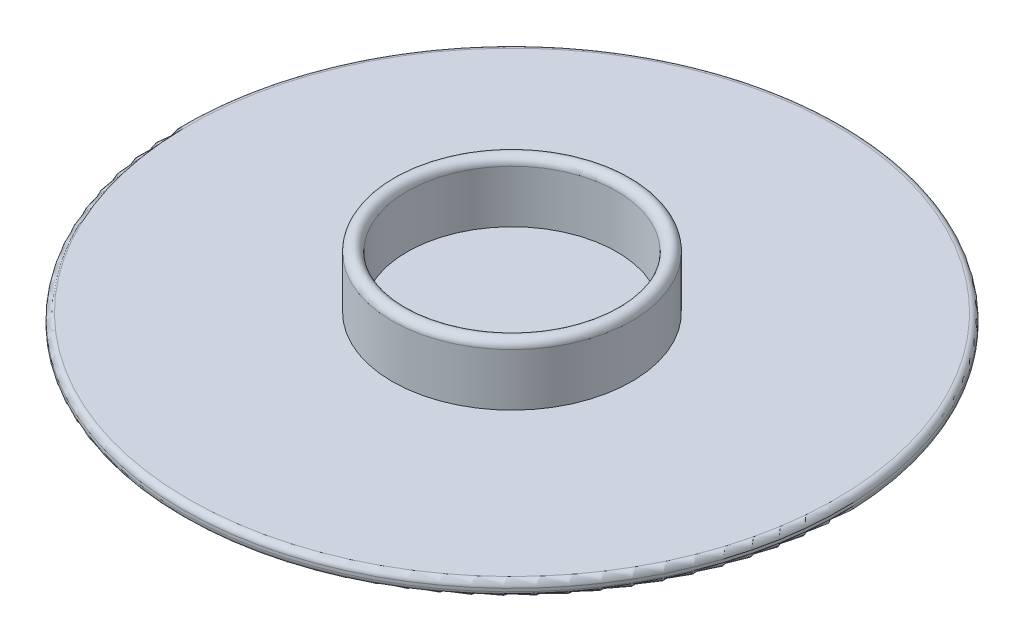
from build123d import *

# Parameters (mm, degrees)
SKETCH_1_R      = 11
EXTRUDE_1_DEPTH = 0.5
SKETCH_2_R      = 4
SKETCH_2_R_2    = 3.5
EXTRUDE_2_DEPTH = 2
FILLET_1_R      = 0.25
FILLET_2_R      = 0.2


with BuildPart() as part:
    # 草图1 → 凸台-拉伸1 (new body)
    with BuildSketch(Plane(origin=(0, 0, 0), x_dir=(1, 0, 0), z_dir=(0, 1, 0))):
        with Locations(Location((0, 0, 0), (0, 0, 270))):
            Circle(SKETCH_1_R)
    extrude(amount=EXTRUDE_1_DEPTH)

    # 草图2 → 凸台-拉伸2 (add)
    with BuildSketch(Plane(origin=(0, 0.5, 0), x_dir=(1, 0, 0), z_dir=(0, 1, 0))):
        with Locations(Location((0, 0, 0), (0, 0, 270))):
            Circle(SKETCH_2_R)
        with Locations(Location((0, 0, 0), (0, 0, 270))):
            Circle(SKETCH_2_R_2, mode=Mode.SUBTRACT)
    extrude(amount=EXTRUDE_2_DEPTH)

    # 圆角1
    fillet_1_edges = [part.edges().sort_by_distance(p)[0] for p in [
        (0, 2.5, -4),
        (0, 2.5, -3.5),
    ]]
    fillet(fillet_1_edges, radius=FILLET_1_R - 0.0001)  # a hair under: the kernel refuses the full size

    # 草图3 → 切除-旋转2 (revolve, cut)
    with BuildSketch(Plane(origin=(0, 0, 0), x_dir=(0, 0, -1), z_dir=(1, 0, 0)), mode=Mode.PRIVATE) as cut_revolve_2_sk:
        with BuildLine():
            Line((0, 0), (8, 0))
            ThreePointArc((8, 0), (4.002811512, 0.224973651), (0, 0.3))
            Line((0, 0.3), (0, 0))
        make_face()
    revolve(cut_revolve_2_sk.sketch.rotate(Axis((0, 0, 0), (0, 1, 0)), 180), axis=Axis((0, 0, 0), (0, 1, 0)), mode=Mode.SUBTRACT)

    # 圆角2
    fillet_2_edges = [part.edges().sort_by_distance(p)[0] for p in [
        (0, 0, -11),
        (0, 0.5, -11),
    ]]
    fillet(fillet_2_edges, radius=FILLET_2_R)


solid = part.part
